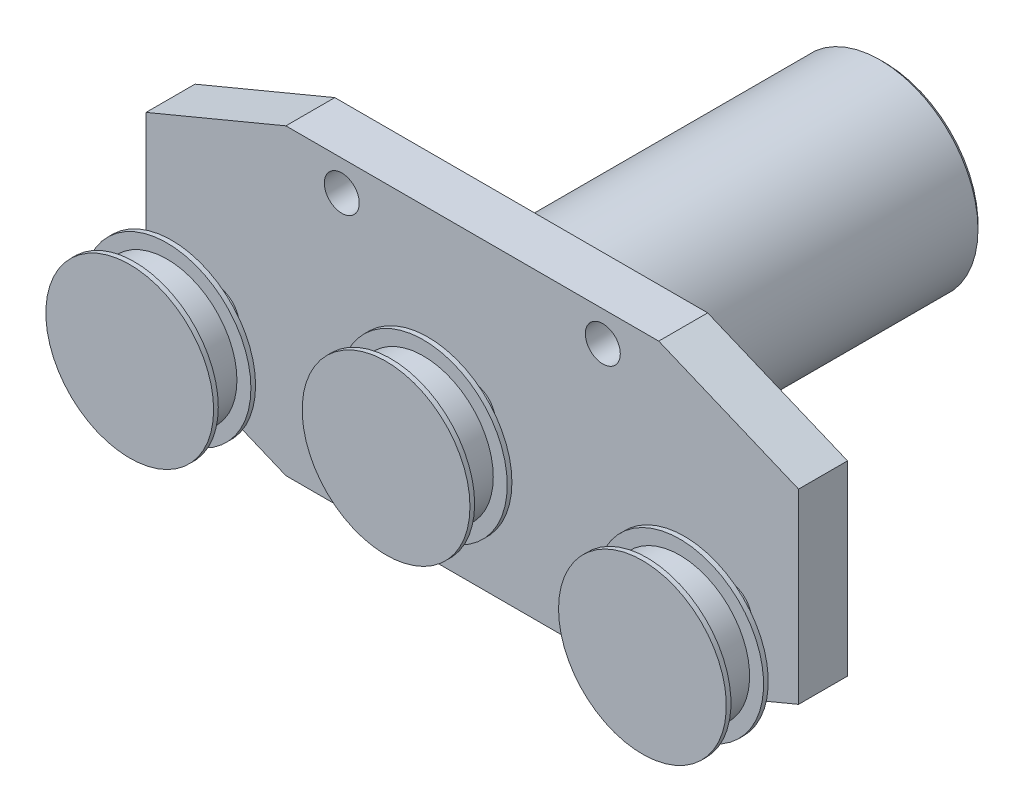
from build123d import *

# Parameters (mm, degrees)
SKETCH1_R           = 2.25
BOSS_EXTRUDE1_DEPTH = 10.5
SKETCH3_R           = 5
BOSS_EXTRUDE2_DEPTH = 9.5
SKETCH4_R           = 3.75
CUT_EXTRUDE1_DEPTH  = 6
SKETCH5_R           = 18
BOSS_EXTRUDE3_DEPTH = 9
SKETCH7_W           = 167.229187532
SKETCH7_H           = 99.836007656
SKETCH7_R           = 15
CUT_EXTRUDE2_DEPTH  = 7
SKETCH8_R           = 21
BOSS_EXTRUDE4_DEPTH = 78
CHAMFER1_SIZE       = 1
SKETCH9_R           = 2
BOSS_EXTRUDE5_DEPTH = 3


with BuildPart() as part:
    # Sketch1 → Boss-Extrude1 (new body)
    with BuildSketch(Plane.XY):
        Polygon((-20, 32.5), (-50, 20), (-50, -20), (-20, -32.5), (20, -32.5), (20, 32.5), align=None)
        with Locations((-8, 26)):
            Circle(SKETCH1_R, mode=Mode.SUBTRACT)
        with Locations((-8, -26)):
            Circle(SKETCH1_R, mode=Mode.SUBTRACT)
    boss_extrude1 = extrude(amount=BOSS_EXTRUDE1_DEPTH)

    # Mirror1: Boss-Extrude1 across plane
    add(boss_extrude1.mirror(Plane(origin=(20, 0, 10.5), x_dir=(0, 0, 1), z_dir=(1, 0, 0))))

    # Sketch3 → Boss-Extrude2 (add)
    with BuildSketch(Plane.XY.offset(10.5)):
        with Locations((20, 0)):
            Circle(SKETCH3_R)
        with Locations((-35, -9.5)):
            Circle(SKETCH3_R)
        with Locations((75, -9.5)):
            Circle(SKETCH3_R)
    extrude(amount=BOSS_EXTRUDE2_DEPTH)

    # Sketch4 → Cut-Extrude1 (cut)
    with BuildSketch(Plane.XY.offset(10.5)):
        with Locations((-8, -26)):
            Circle(SKETCH4_R)
        with Locations((-8, 26)):
            Circle(SKETCH4_R)
        with Locations((48, 26)):
            Circle(SKETCH4_R)
        with Locations((48, -26)):
            Circle(SKETCH4_R)
    extrude(amount=-CUT_EXTRUDE1_DEPTH, mode=Mode.SUBTRACT)

    # Sketch5 → Boss-Extrude3 (add)
    with BuildSketch(Plane.XY.offset(20)):
        with Locations((20, 0)):
            Circle(SKETCH5_R)
        with Locations((-35, -9.5)):
            Circle(SKETCH5_R)
    extrude(amount=BOSS_EXTRUDE3_DEPTH)

    # Sketch7 → Cut-Extrude2 (cut)
    with BuildSketch(Plane.XY.offset(28)):
        with Locations((-35, -9.5)):
            Rectangle(SKETCH7_W, SKETCH7_H)
        with Locations((-35, -9.5)):
            Circle(SKETCH7_R, mode=Mode.SUBTRACT)
        with Locations((20, 0)):
            Circle(SKETCH7_R, mode=Mode.SUBTRACT)
    extrude(amount=-CUT_EXTRUDE2_DEPTH, mode=Mode.SUBTRACT)

    # Mirror2: part across plane


with BuildPart() as part_1:
    add(part.part)
    add(part.part.mirror(Plane(origin=(20, 0, 0), x_dir=(0, 0, 1), z_dir=(1, 0, 0))))

    # Sketch8 → Boss-Extrude4 (add)
    with BuildSketch(Plane(origin=(0, 0, 0), x_dir=(-1, 0, 0), z_dir=(0, 0, -1))):
        with Locations((-20, 0)):
            Circle(SKETCH8_R)
    extrude(amount=BOSS_EXTRUDE4_DEPTH)

    # Chamfer1
    chamfer1_edges = [part_1.edges().sort_by_distance(p)[0] for p in [
        (41, 0, -78),
    ]]
    chamfer(chamfer1_edges, length=CHAMFER1_SIZE)

    # Sketch9 → Boss-Extrude5 (add, symmetric)
    with BuildSketch(Plane(origin=(0, 0, 0), x_dir=(-1, 0, 0), z_dir=(0, 0, -1))):
        with Locations((-75, -9.5)):
            Circle(SKETCH9_R)
        with Locations((35, -9.5)):
            Circle(SKETCH9_R)
    extrude(amount=BOSS_EXTRUDE5_DEPTH, both=True)


solid = part_1.part
